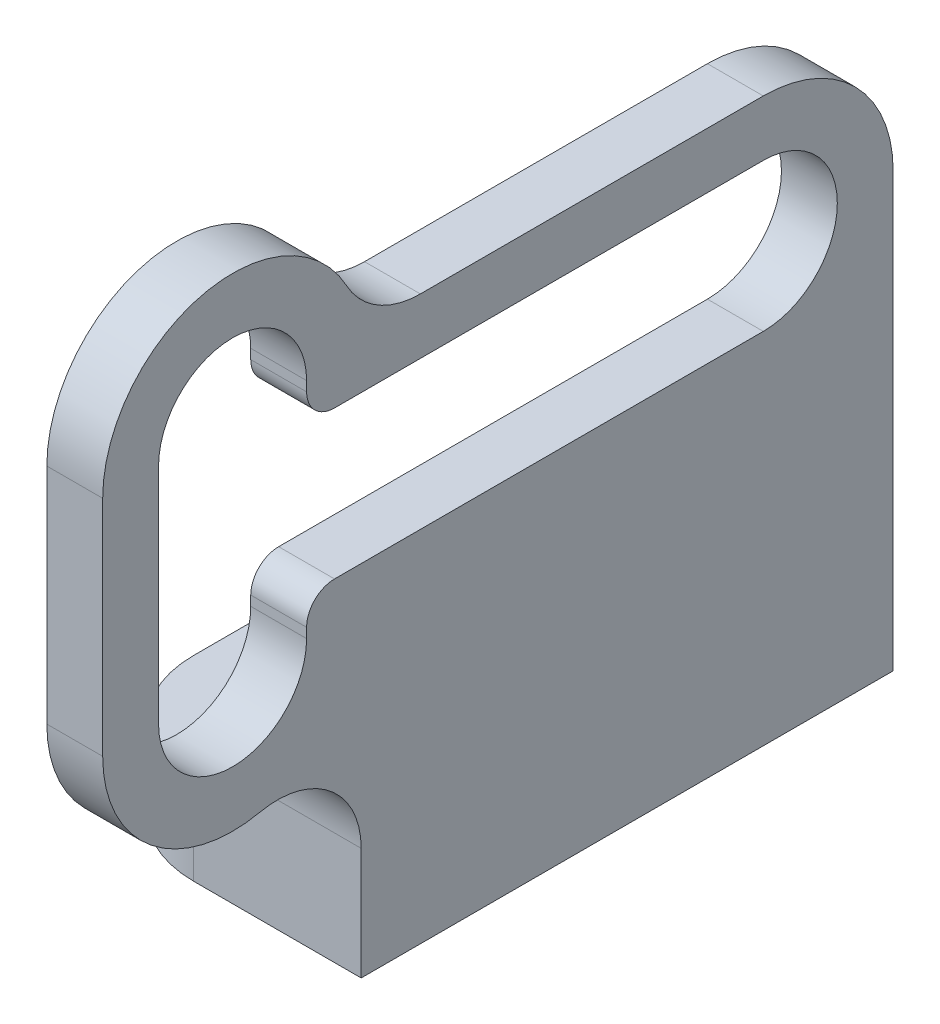
from build123d import *

# Parameters (mm, degrees)
BOSS_EXTRUDE1_DEPTH = 2
BOSS_EXTRUDE2_START = -16
BOSS_EXTRUDE2_DEPTH = 2
SKETCH3_W           = 19.045654227
SKETCH3_H           = 3
BOSS_EXTRUDE3_DEPTH = 8
FILLET1_R           = 4
SKETCH5_W           = 1
SKETCH5_H           = 3
HOLE1_AT_2_COUNT    = 2
HOLE1_AT_2_PITCH    = 11.045654227
CUT_EXTRUDE1_START  = 2
SKETCH6_R           = 1
CUT_EXTRUDE1_DEPTH  = 2
FILLET2_R           = 3
FILLET3_R           = 3


# Read off the part's stored shape, not the designer's step: Boss-Extrude2
with BuildPart() as part:
    # Sketch1 → Boss-Extrude1 (new body)
    with BuildSketch(Plane.ZY.offset(14)):
        with BuildLine():
            Line((12.895654227, 10.15), (-1.5, 10.15))
            ThreePointArc((-1.5, 10.15), (-6.15, 5.5), (-1.5, 0.85))
            Line((-1.5, 0.85), (12.895654227, 0.85))
            ThreePointArc((12.895654227, 0.85), (17.825800671, -3.138572401), (22.15, 1.5))
            Line((22.15, 1.5), (22.15, 9.5))
            ThreePointArc((22.15, 9.5), (17.825800671, 14.138572401), (12.895654227, 10.15))
        make_face()
        with BuildLine():
            Line((13.85, 8.15), (-1.5, 8.15))
            ThreePointArc((-1.5, 8.15), (-4.15, 5.5), (-1.5, 2.85))
            Line((-1.5, 2.85), (13.85, 2.85))
            ThreePointArc((13.85, 2.85), (14.557106781, 2.557106781), (14.85, 1.85))
            Line((14.85, 1.85), (14.85, 1.5))
            ThreePointArc((14.85, 1.5), (17.5, -1.15), (20.15, 1.5))
            Line((20.15, 1.5), (20.15, 9.5))
            ThreePointArc((20.15, 9.5), (17.5, 12.15), (14.85, 9.5))
            Line((14.85, 9.5), (14.85, 9.15))
            ThreePointArc((14.85, 9.15), (14.557106781, 8.442893219), (13.85, 8.15))
        make_face(mode=Mode.SUBTRACT)
    extrude(amount=BOSS_EXTRUDE1_DEPTH)

    # Boss-Extrude2 outline → Boss-Extrude2 (add)
    with BuildSketch(Plane.YZ.offset(BOSS_EXTRUDE2_START)):
        with BuildLine():
            Line((-10, 12.895654227), (-10, -6.15))
            Line((-10, -6.15), (5.5, -6.15))
            ThreePointArc((5.5, -6.15), (2.211953467, -4.788046533), (0.85, -1.5))
            Line((0.85, -1.5), (0.85, 12.895654227))
            Line((0.85, 12.895654227), (-10, 12.895654227))
        make_face()
    extrude(amount=BOSS_EXTRUDE2_DEPTH)

    # Sketch3 → Boss-Extrude3 (add)
    with BuildSketch(Plane.ZY.offset(16)):
        with Locations((3.372827114, -8.5)):
            Rectangle(SKETCH3_W, SKETCH3_H)
    extrude(amount=BOSS_EXTRUDE3_DEPTH)

    # Fillet1
    fillet1_edges = [part.edges().sort_by_distance(p)[0] for p in [
        (-24, -8.5, 12.895654227),
        (-24, -8.5, -6.15),
        (-16, -7, 3.372827113),
    ]]
    fillet(fillet1_edges, radius=FILLET1_R - 0.0001)  # a hair under: the kernel refuses the full size

    # Sketch5 → Hole1 (revolve, cut)
    with BuildSketch(Plane(origin=(-20, -7, -2.15), x_dir=(0, 0, 1), z_dir=(1, 0, 0))):
        with Locations((0.5, 1.5)):
            Rectangle(SKETCH5_W, SKETCH5_H)
    hole1 = revolve(axis=Axis((-20, -117, -2.15), (0, 1, 0)), mode=Mode.SUBTRACT)

    # Hole1 at 2: Hole1 ×2
    with Locations(*[(0, 0, i * HOLE1_AT_2_PITCH) for i in range(1, HOLE1_AT_2_COUNT)]):
        add(hole1, mode=Mode.SUBTRACT)

    # Sketch6 → Cut-Extrude1 (cut)
    with BuildSketch(Plane(origin=(0, -7, 0), x_dir=(1, 0, 0), z_dir=(0, 1, 0)).offset(CUT_EXTRUDE1_START)):
        with Locations(Location((-20, -8.895654227, 0), (0, 0, 270))):
            Circle(SKETCH6_R)
        with Locations(Location((-20, 2.15, 0), (0, 0, 270))):
            Circle(SKETCH6_R)
    extrude(amount=-CUT_EXTRUDE1_DEPTH, mode=Mode.SUBTRACT)

    # Fillet2
    fillet2_edges = [part.edges().sort_by_distance(p)[0] for p in [
        (-15, 10.15, 12.895654227),
    ]]
    fillet(fillet2_edges, radius=FILLET2_R)

    # Fillet3
    fillet3_edges = [part.edges().sort_by_distance(p)[0] for p in [
        (-15, 0.85, 12.895654227),
    ]]
    fillet(fillet3_edges, radius=FILLET3_R)


solid = part.part
